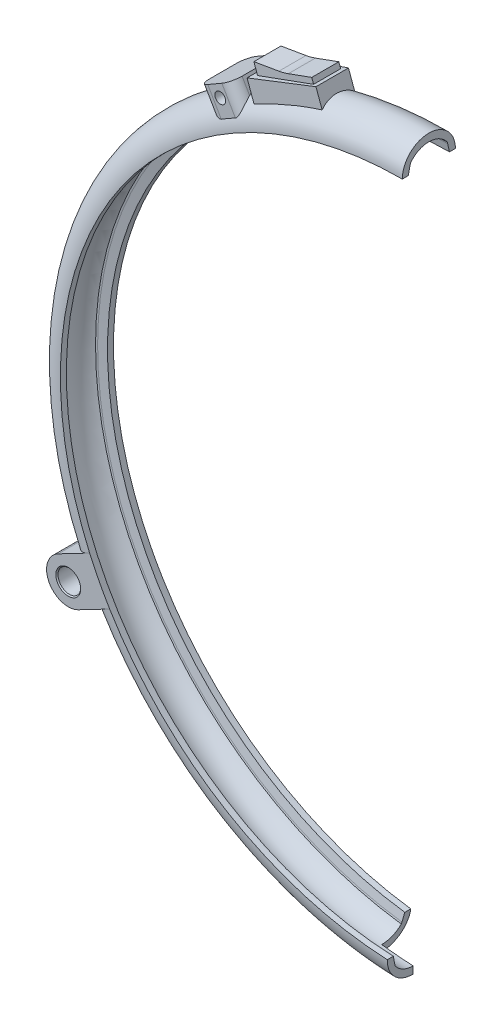
from build123d import *

# Parameters (mm, degrees)
REVOLVE1_ANGLE                 = 177.5
BOSS_EXTRUDE1_REACH            = 72.435
BOSS_EXTRUDE1_END_MAJOR_RADIUS = 31.55
BOSS_EXTRUDE1_END_MINOR_RADIUS = 2.45
BOSS_EXTRUDE2_DEPTH            = 1.25
BOSS_EXTRUDE3_REACH            = 68.663
BOSS_EXTRUDE3_END_RADIUS       = 31.55
SKETCH7_R                      = 0.5
CUT_EXTRUDE1_DEPTH             = 49.523762708
BOSS_EXTRUDE4_START            = -2.45
BOSS_EXTRUDE4_DEPTH            = 4.9
BOSS_EXTRUDE5_DEPTH            = 4.9
SKETCH11_R                     = 1.05
CUT_EXTRUDE2_DEPTH             = 49.543542798
CHAMFER1_SIZE                  = 0.1
CUT_REVOLVE4_ANGLE             = 5


# Read off the part's stored shape, not the designer's step: Boss-Extrude4
with BuildPart() as part:
    # Sketch1 → Revolve1 (revolve)
    with BuildSketch(Plane(origin=(0, 0, 0), x_dir=(0, 0, -1), z_dir=(1, 0, 0))):
        with BuildLine():
            Line((-1.9, 31.55), (-2.45, 31.55))
            ThreePointArc((-2.45, 31.55), (0, 34), (2.45, 31.55))
            Line((2.45, 31.55), (1.9, 31.55))
            Line((1.9, 31.55), (1.732550899, 32.3))
            ThreePointArc((1.732550899, 32.3), (1.713964889, 32.375442776), (1.692095441, 32.45))
            ThreePointArc((1.692095441, 32.45), (0, 33.306290622), (-1.692095441, 32.45))
            ThreePointArc((-1.692095441, 32.45), (-1.713964889, 32.375442776), (-1.732550899, 32.3))
            Line((-1.732550899, 32.3), (-1.9, 31.55))
        make_face()
    revolve(axis=Axis((0, 0, -25.465534681), (0, 0, 1)), revolution_arc=REVOLVE1_ANGLE)



with BuildPart() as body_2:
    # Boss-Extrude1: up to this torus (the profile starts outside it)
    boss_extrude1_end = Plane(origin=(0, 0, 0), z_dir=(0, 0, -1)) * Torus(BOSS_EXTRUDE1_END_MAJOR_RADIUS, BOSS_EXTRUDE1_END_MINOR_RADIUS, mode=Mode.PRIVATE)
    # Sketch4 → Boss-Extrude1 (new, up to the surface)
    with BuildSketch(Plane(origin=(-11.970705016, 32.889241728, 0), x_dir=(-0.9396926207859083, -0.34202014332566943, 0), z_dir=(0.34202014332566943, -0.9396926207859083, 0)), mode=Mode.PRIVATE) as boss_extrude1_sk1:
        Polygon((3.25, 1.75), (-3.25, 1.5), (-3.25, -1.5), (3.25, -1.75), align=None)
    boss_extrude1_tool1 = extrude(boss_extrude1_sk1.sketch, amount=BOSS_EXTRUDE1_REACH, mode=Mode.PRIVATE) - boss_extrude1_end
    add(boss_extrude1_tool1.solids().sort_by_distance((-12.049013, 32.86074, 0))[0])


with BuildPart() as part_1:
    add(part.part)

    add(body_2.part)  # Boss-Extrude2 merges body 2
    # Sketch5 → Boss-Extrude2 (add, symmetric)
    with BuildSketch(Plane.XY):
        with BuildLine():
            Line((-14.896879867, 32.888378954), (-14.554859724, 31.948686333))
            Line((-14.554859724, 31.948686333), (-9.386550309, 33.829797122))
            Line((-9.386550309, 33.829797122), (-9.557560381, 34.299643432))
            Line((-9.557560381, 34.299643432), (-11.718054934, 33.513287723))
            ThreePointArc((-11.718054934, 33.513287723), (-12.14691319, 33.378696125), (-12.586125644, 33.28316224))
            Line((-12.586125644, 33.28316224), (-14.896879867, 32.888378954))
        make_face()
    extrude(amount=BOSS_EXTRUDE2_DEPTH, both=True)

    # Boss-Extrude3: up to this cylinder (the profile starts outside it)
    boss_extrude3_end = Plane(origin=(0, 0, 0), z_dir=(0, 0, -1)) * Cylinder(BOSS_EXTRUDE3_END_RADIUS, 201.426, mode=Mode.PRIVATE)
    # Sketch6 → Boss-Extrude3 (add, up to the surface)
    with BuildSketch(Plane(origin=(-17.5, 30.310889132, 0), x_dir=(0.866025403784438, 0.5000000000000012, 0), z_dir=(-0.5000000000000012, 0.866025403784438, 0)), mode=Mode.PRIVATE) as boss_extrude3_sk1:
        with BuildLine():
            Line((-0.75, -2.25), (0.75, -2.25))
            ThreePointArc((0.75, -2.25), (1.457106781, -1.957106781), (1.75, -1.25))
            Line((1.75, -1.25), (1.75, 1.25))
            ThreePointArc((1.75, 1.25), (1.457106781, 1.957106781), (0.75, 2.25))
            Line((0.75, 2.25), (-0.75, 2.25))
            ThreePointArc((-0.75, 2.25), (-1.457106781, 1.957106781), (-1.75, 1.25))
            Line((-1.75, 1.25), (-1.75, -1.25))
            ThreePointArc((-1.75, -1.25), (-1.457106781, -1.957106781), (-0.75, -2.25))
        make_face()
    boss_extrude3_tool1 = extrude(boss_extrude3_sk1.sketch, amount=-BOSS_EXTRUDE3_REACH, mode=Mode.PRIVATE) - boss_extrude3_end
    add(boss_extrude3_tool1.solids().sort_by_distance((-17.5, 30.310889, 0))[0])

    # Sketch7 → Cut-Extrude1 (cut, through all)
    with BuildSketch(Plane.XY.offset(2.25)):
        with Locations((-17, 29.444863729)):
            Circle(SKETCH7_R)
    extrude(amount=-CUT_EXTRUDE1_DEPTH, mode=Mode.SUBTRACT)

    # Boss-Extrude4 outline → Boss-Extrude4 (add)
    with BuildSketch(Plane.XY.offset(BOSS_EXTRUDE4_START)):
        with BuildLine():
            Line((-29.900129226, -17.819785976), (-27.005409062, -16.312890038))
            ThreePointArc((-27.005409062, -16.312890038), (-27.985191787, -14.568168747), (-28.852403515, -12.764846705))
            Line((-28.852403515, -12.764846705), (-31.747123679, -14.271742644))
            Line((-31.747123679, -14.271742644), (-29.900129226, -17.819785976))
        make_face()
    extrude(amount=BOSS_EXTRUDE4_DEPTH)

    # Sketch10 → Boss-Extrude5 (add)
    with BuildSketch(Plane.XY.offset(2.45)):
        with BuildLine():
            Line((-31.747123679, -14.271742644), (-29.900129226, -17.819785976))
            ThreePointArc((-29.900129226, -17.819785976), (-32.597648119, -16.969261536), (-31.747123679, -14.271742644))
        make_face()
    extrude(amount=-BOSS_EXTRUDE5_DEPTH)

    # Sketch11 → Cut-Extrude2 (cut, through all)
    with BuildSketch(Plane.XY.offset(2.45)):
        with Locations((-30.823626453, -16.04576431)):
            Circle(SKETCH11_R)
    extrude(amount=-CUT_EXTRUDE2_DEPTH, mode=Mode.SUBTRACT)

    # Chamfer1
    chamfer1_edges = [part_1.edges().sort_by_distance(p)[0] for p in [
        (-31.873626453, -16.04576431, -2.45),
        (-31.873626453, -16.04576431, 2.45),
    ]]
    chamfer(chamfer1_edges, length=CHAMFER1_SIZE)

    # Sketch12 → Cut-Revolve2 (revolve, cut)
    with BuildSketch(Plane(origin=(0, 0, 0), x_dir=(0, 0, -1), z_dir=(1, 0, 0))):
        with BuildLine():
            Line((-1.9, 31.55), (1.9, 31.55))
            Line((1.9, 31.55), (1.732550899, 32.3))
            ThreePointArc((1.732550899, 32.3), (1.713964889, 32.375442776), (1.692095441, 32.45))
            ThreePointArc((1.692095441, 32.45), (0, 33.306290622), (-1.692095441, 32.45))
            ThreePointArc((-1.692095441, 32.45), (-1.713964889, 32.375442776), (-1.732550899, 32.3))
            Line((-1.732550899, 32.3), (-1.9, 31.55))
        make_face()
    revolve(axis=Axis((0, 0, -14.066037571), (0, 0, 1)), mode=Mode.SUBTRACT)

    # Sketch13 → Cut-Revolve4 (revolve, cut)
    with BuildSketch(Plane(origin=(0, 0, 0), x_dir=(0, 0, -1), z_dir=(0.999048221581858, -0.043619387365329415, 0))):
        with BuildLine():
            Line((0, -33.306290622), (0, -34))
            ThreePointArc((0, -34), (1.732411614, -33.282411614), (2.45, -31.55))
            Line((2.45, -31.55), (1.9, -31.55))
            Line((1.9, -31.55), (1.732550899, -32.3))
            ThreePointArc((1.732550899, -32.3), (1.713964889, -32.375442776), (1.692095441, -32.45))
            ThreePointArc((1.692095441, -32.45), (0.948211555, -33.080028823), (0, -33.306290622))
        make_face()
    revolve(axis=Axis((0, 0, -14.693028928), (0, 0, -1)), revolution_arc=CUT_REVOLVE4_ANGLE, mode=Mode.SUBTRACT)


solid = part_1.part
